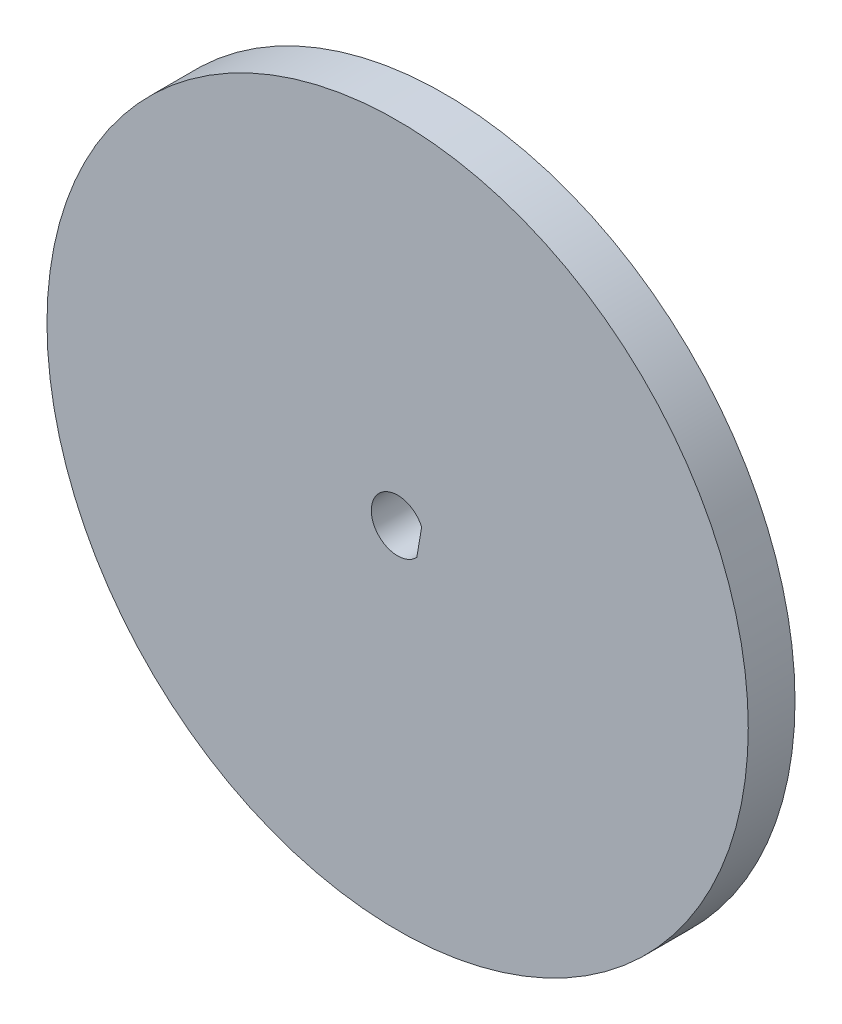
from build123d import *

# Parameters (mm, degrees)
SKETCH1_R           = 40
BOSS_EXTRUDE1_DEPTH = 5.334
CUT_EXTRUDE1_DEPTH  = 73.172531324


with BuildPart() as part:
    # Sketch1 → Boss-Extrude1 (new body)
    with BuildSketch(Plane.XY):
        with Locations((-10.991688671, 10.796362155)):
            Circle(SKETCH1_R)
    extrude(amount=BOSS_EXTRUDE1_DEPTH)

    # Sketch3 → Cut-Extrude1 (cut, through all)
    with BuildSketch(Plane.XY.offset(5.334)):
        with BuildLine():
            Line((-8.526986497, 10.377741567), (-8.249305013, 12.012640033))
            ThreePointArc((-8.249305013, 12.012640033), (-13.949331278, 11.298706861), (-8.804667981, 8.742843101))
            Line((-8.804667981, 8.742843101), (-8.526986497, 10.377741567))
        make_face()
    extrude(amount=-CUT_EXTRUDE1_DEPTH, mode=Mode.SUBTRACT)


solid = part.part
